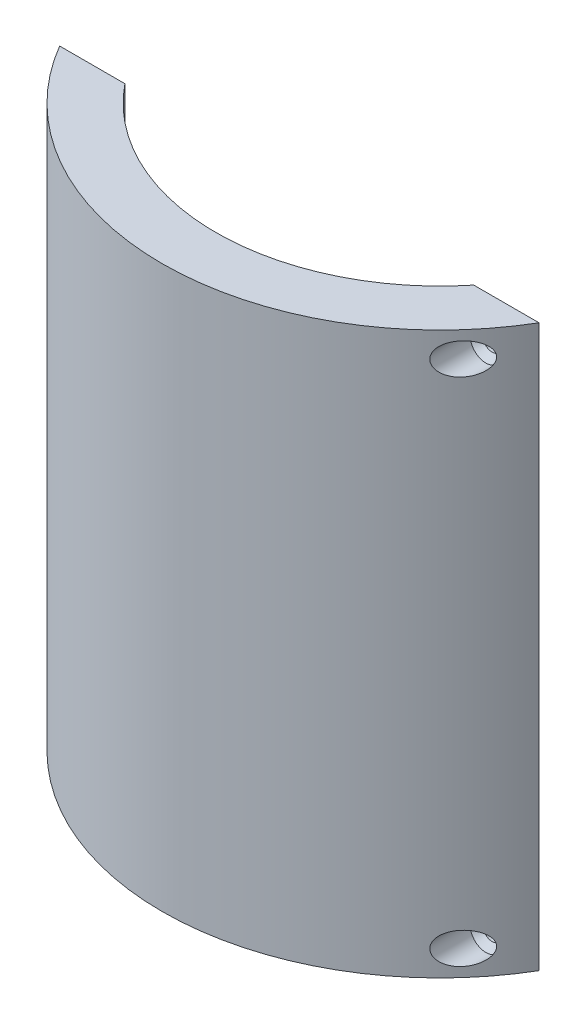
from build123d import *

# Parameters (mm, degrees)
BOSS_EXTRUDE1_DEPTH = 100


with BuildPart() as part:
    # Sketch1 → Boss-Extrude1 (new body)
    with BuildSketch(Plane(origin=(0, 0, 0), x_dir=(1, 0, 0), z_dir=(0, 1, 0))):
        with BuildLine():
            ThreePointArc((31.086694629, -25.07), (0, -39.936042405), (-31.086694629, -25.07))
            Line((-31.086694629, -25.07), (-42.716694629, -25.07))
            ThreePointArc((-42.716694629, -25.07), (0, -49.53), (42.716694629, -25.07))
            Line((42.716694629, -25.07), (31.086694629, -25.07))
        make_face()
    extrude(amount=BOSS_EXTRUDE1_DEPTH)

    # Sketch6 → Cut-Revolve4 (revolve, cut)
    with BuildSketch(Plane(origin=(36.901694629, 4.5125, 25.07), x_dir=(-1, 0, 0), z_dir=(0, -1, 0))):
        Polygon((0, 1.685394277), (0, -4.78184701), (0, -15.185924704), (-2.8, -15.185924704), (-2.8, -3.644124056), (-1.65, -2.542828176), (-1.65, 1.685394277), align=None)
    cut_revolve4 = revolve(axis=Axis((36.901694629, 4.5125, 23.384605723), (0, 0, 1)), mode=Mode.SUBTRACT)

    # Mirror1: Cut-Revolve4 across plane
    add(cut_revolve4.mirror(Plane(origin=(0, 50, 0), x_dir=(0, 0, 1), z_dir=(0, -1, 0))), mode=Mode.SUBTRACT)

    # Mirror1 at the second plane: Cut-Revolve4 across plane
    add(cut_revolve4.mirror(Plane(origin=(0, 0, 0), x_dir=(0, 0, 1), z_dir=(1, 0, 0))), mode=Mode.SUBTRACT)

    # Mirror1 at the second plane copy 1 sketc → Mirror1 at the second plane copy 1 (revolve, cut)
    with BuildSketch(Plane(origin=(-36.901694629, 95.4875, 25.07), x_dir=(1, 0, 0), z_dir=(0, 1, 0))):
        Polygon((0, 1.685394277), (0, -4.78184701), (0, -15.185924704), (-2.8, -15.185924704), (-2.8, -3.644124056), (-1.65, -2.542828176), (-1.65, 1.685394277), align=None)
    revolve(axis=Axis((-36.901694629, 95.4875, 23.384605723), (0, 0, 1)), mode=Mode.SUBTRACT)


solid = part.part
